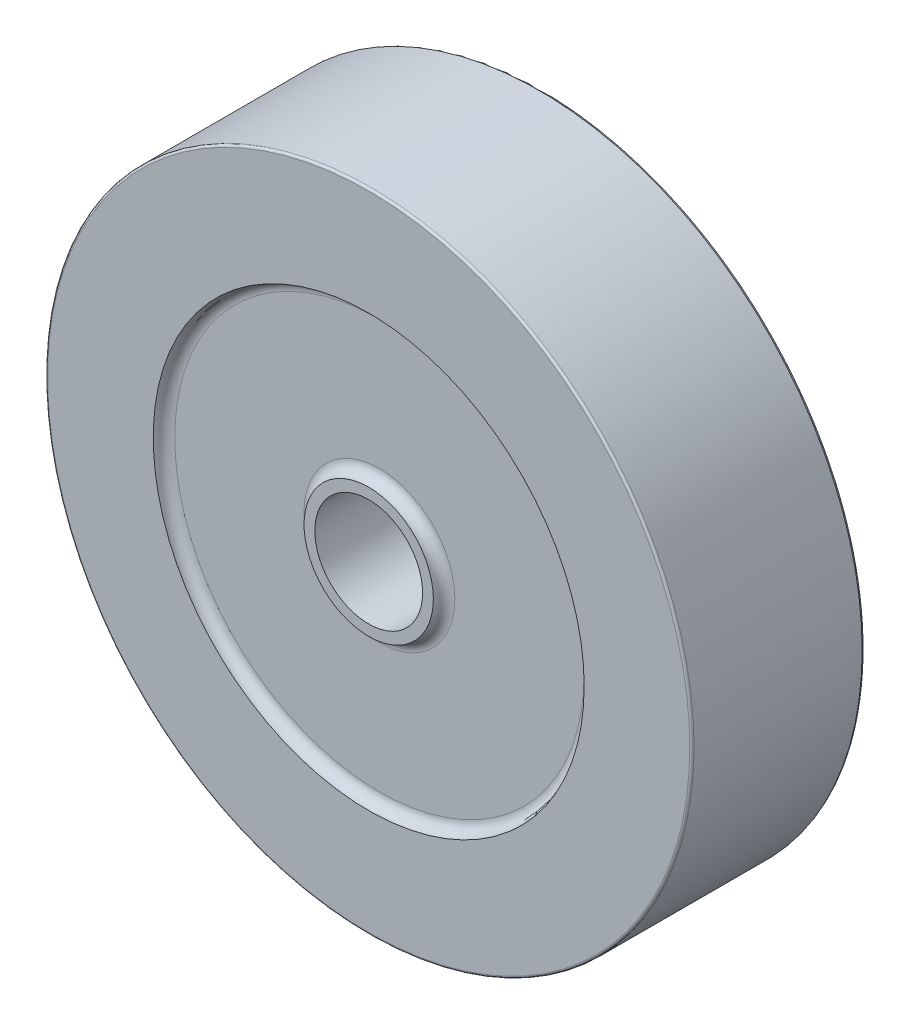
from build123d import *

# Parameters (mm, degrees)
SKETCH3_R          = 6.35
CUT_EXTRUDE1_DEPTH = 58.585782968
FILLET1_R          = 1.27
FILLET2_R          = 0.254
SKETCH4_W          = 12.7
SKETCH4_H          = 12.7
CUT_EXTRUDE2_DEPTH = 5.08


with BuildPart() as part:
    # Sketch2 → Revolve1 (revolve)
    with BuildSketch(Plane(origin=(0, 0, 0), x_dir=(0, 0, -1), z_dir=(1, 0, 0)), mode=Mode.PRIVATE) as revolve1_sk:
        Polygon((0, -7.62), (1.27, -7.62), (1.27, -25.4), (0, -25.4), (0, -38.1), (20.32, -38.1), (20.32, -25.4), (19.05, -25.4), (19.05, -11.43), (20.32, -11.43), (20.32, 0), (0, 0), align=None)
    revolve(revolve1_sk.sketch.rotate(Axis((0, 0, 0), (0, 0, -1)), 270), axis=Axis((0, 0, 0), (0, 0, -1)))

    # Sketch3 → Cut-Extrude1 (cut, through all)
    with BuildSketch(Plane.XY):
        Circle(SKETCH3_R)
    extrude(amount=-CUT_EXTRUDE1_DEPTH, mode=Mode.SUBTRACT)

    # Fillet1
    fillet1_edges = [part.edges().sort_by_distance(p)[0] for p in [
        (-25.4, 0, -19.05),
        (-25.4, 0, -1.27),
        (-7.62, 0, -1.27),
        (-11.43, 0, -19.05),
    ]]
    fillet(fillet1_edges, radius=FILLET1_R - 0.0001)  # a hair under: the kernel refuses the full size

    # Fillet2
    fillet2_edges = [part.edges().sort_by_distance(p)[0] for p in [
        (-38.1, 0, -20.32),
        (-38.1, 0, 0),
    ]]
    fillet(fillet2_edges, radius=FILLET2_R)

    # Sketch4 → Cut-Extrude2 (cut)
    with BuildSketch(Plane(origin=(0, 0, -20.32), x_dir=(-1, 0, 0), z_dir=(0, 0, -1))):
        Rectangle(SKETCH4_W, SKETCH4_H)
    extrude(amount=-CUT_EXTRUDE2_DEPTH, mode=Mode.SUBTRACT)


solid = part.part
